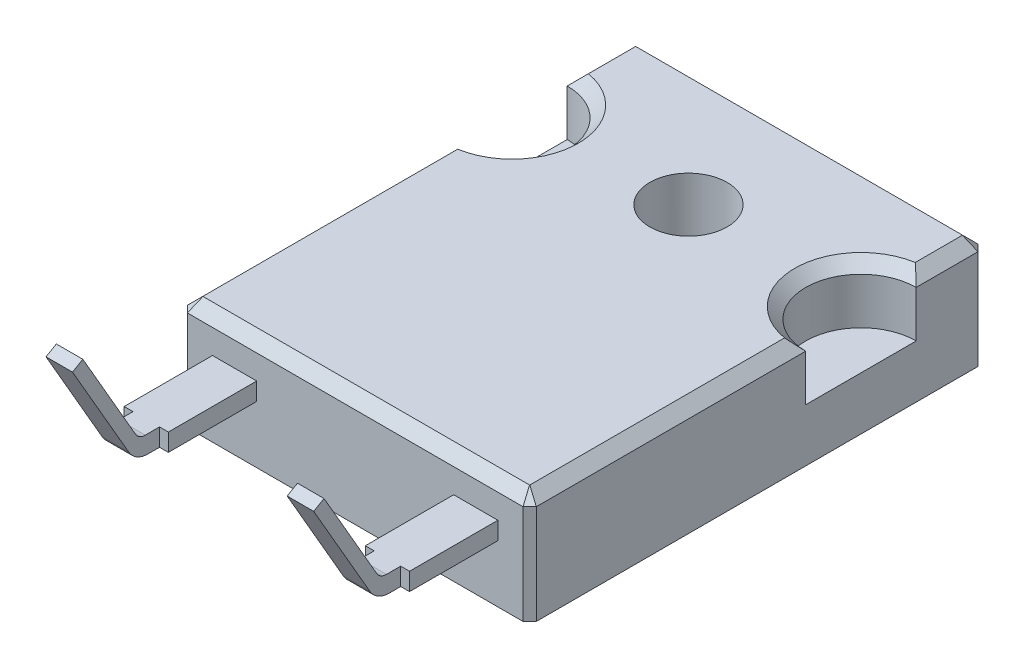
from build123d import *

# Parameters (mm, degrees)
SKETCH_1_R          = 1.75
EXTRUDE_1_DEPTH     = 2.6
EXTRUDE_START       = -2.4
SKETCH_1_3_W        = 15.8
SKETCH_1_3_H        = 20.6
SKETCH_1_3_R        = 1.75
EXTRUDE_2_DEPTH     = 2.4
EXTRUDE_START_2     = 0.2
EXTRUDE_3_DEPTH     = 0.8
EXTRUDE_3_2_DEPTH   = 0.8
CHAMFER_1_SIZE      = 0.3
CHAMFER_2_SIZE      = 0.5
SKETCH_2_W          = 13.8
SKETCH_2_H          = 18.6
SKETCH_2_R          = 1.75
CUT_EXTRUDE_1_DEPTH = 1.5
SKETCH_3_W          = 1.2
SKETCH_3_H          = 0.54
EXTRUDE_6_DEPTH     = 5.68
FILLET_1_R          = 1
FILLET_2_R          = 1
FILLET_3_R          = 0.5
FILLET_4_R          = 0.5


with BuildPart() as part:
    # Эскиз1 → Бобышка-Вытянуть1 (new body)
    with BuildSketch(Plane(origin=(0, 0, 0), x_dir=(1, 0, 0), z_dir=(0, 1, 0))):
        with BuildLine():
            Line((6.46, -10.3), (7.9, -10.3))
            Line((7.9, -10.3), (7.9, 2.2))
            ThreePointArc((7.9, 2.2), (5.4, 4.7), (7.9, 7.2))
            Line((7.9, 7.2), (7.9, 10.3))
            Line((7.9, 10.3), (-7.9, 10.3))
            Line((-7.9, 10.3), (-7.9, 7.2))
            ThreePointArc((-7.9, 7.2), (-5.4, 4.7), (-7.9, 2.2))
            Line((-7.9, 2.2), (-7.9, -10.3))
            Line((-7.9, -10.3), (-6.46, -10.3))
            Line((-6.46, -10.3), (-4.46, -10.3))
            Line((-4.46, -10.3), (4.46, -10.3))
            Line((4.46, -10.3), (6.46, -10.3))
        make_face()
        with Locations((0, 4.79)):
            Circle(SKETCH_1_R, mode=Mode.SUBTRACT)
    extrude(amount=EXTRUDE_1_DEPTH)

    # Эскиз1<3> → Бобышка-Вытянуть2 (add)
    with BuildSketch(Plane(origin=(0, 0, 0), x_dir=(1, 0, 0), z_dir=(0, 1, 0)).offset(EXTRUDE_START)):
        Rectangle(SKETCH_1_3_W, SKETCH_1_3_H)
        with Locations((0, 4.79)):
            Circle(SKETCH_1_3_R, mode=Mode.SUBTRACT)
    extrude(amount=EXTRUDE_2_DEPTH)

    # Фаска1
    chamfer_1_edges = [part.edges().sort_by_distance(p)[0] for p in [
        (-7.9, 0.1, 10.3),
        (-7.9, 0.1, -10.3),
        (7.9, 0.1, -10.3),
        (7.9, 0.1, 10.3),
    ]]
    chamfer(chamfer_1_edges, length=CHAMFER_1_SIZE)

    # Фаска2
    chamfer_2_edges = [part.edges().sort_by_distance(p)[0] for p in [
        (-5.4, 2.6, -4.7),
        (-7.9, 2.6, -8.6),
        (-7.75, 2.6, -10.15),
        (0, 2.6, -10.3),
        (7.75, 2.6, -10.15),
        (7.9, 2.6, -8.6),
        (5.4, 2.6, -4.7),
        (7.9, 2.6, 3.9),
        (7.75, 2.6, 10.15),
        (0, 2.6, 10.3),
        (-7.75, 2.6, 10.15),
        (-7.9, 2.6, 3.9),
    ]]
    chamfer(chamfer_2_edges, length=CHAMFER_2_SIZE)

    # Эскиз2 → Вырез-Вытянуть1 (cut)
    with BuildSketch(Plane.XZ.offset(2.4)):
        Rectangle(SKETCH_2_W, SKETCH_2_H)
        with Locations((0, -4.79)):
            Circle(SKETCH_2_R, mode=Mode.SUBTRACT)
    extrude(amount=-CUT_EXTRUDE_1_DEPTH, mode=Mode.SUBTRACT)


with BuildPart() as body_2:
    # Эскиз1<4> → Бобышка-Вытянуть3 (new body)
    with BuildSketch(Plane(origin=(0, 0, 0), x_dir=(1, 0, 0), z_dir=(0, 1, 0)).offset(EXTRUDE_START_2)):
        Polygon((6.46, -14.3), (6.46, -10.3), (4.46, -10.3), (4.46, -14.3), (4.86, -14.3), (4.86, -15.4), (6.06, -15.4), (6.06, -14.3), align=None)
    extrude(amount=EXTRUDE_3_DEPTH)



with BuildPart() as body_3:
    # Эскиз1<4> → Extrude 3 2 (new body)
    with BuildSketch(Plane(origin=(0, 0, 0), x_dir=(1, 0, 0), z_dir=(0, 1, 0)).offset(EXTRUDE_START_2)):
        Polygon((-4.46, -14.3), (-4.46, -10.3), (-6.46, -10.3), (-6.46, -14.3), (-6.06, -14.3), (-6.06, -15.4), (-4.86, -15.4), (-4.86, -14.3), align=None)
    extrude(amount=EXTRUDE_3_2_DEPTH)


with BuildPart() as body_2_1:
    add(body_2.part)

    add(body_3.part)  # Бобышка-Вытянуть6 merges body 3
    # Эскиз3 → Бобышка-Вытянуть6 (add)
    with BuildSketch(Plane(origin=(0, 6.818395609, 3.93660254), x_dir=(1, 0, 0), z_dir=(0, -0.866025403784438, -0.500000000000001))):
        with Locations((-5.46, 12.966791218)):
            Rectangle(SKETCH_3_W, SKETCH_3_H)
        with Locations((5.46, 12.966791218)):
            Rectangle(SKETCH_3_W, SKETCH_3_H)
    extrude(amount=-EXTRUDE_6_DEPTH)

    # Скругление1
    fillet_1_edges = [body_2_1.edges().sort_by_distance(p)[0] for p in [
        (-5.46, 0.2, 15.4),
    ]]
    fillet(fillet_1_edges, radius=FILLET_1_R)

    # Скругление2
    fillet_2_edges = [body_2_1.edges().sort_by_distance(p)[0] for p in [
        (5.46, 0.2, 15.4),
    ]]
    fillet(fillet_2_edges, radius=FILLET_2_R)

    # Скругление3
    fillet_3_edges = [body_2_1.edges().sort_by_distance(p)[0] for p in [
        (5.46, 1, 15.238341925),
    ]]
    fillet(fillet_3_edges, radius=FILLET_3_R)

    # Скругление4
    fillet_4_edges = [body_2_1.edges().sort_by_distance(p)[0] for p in [
        (-5.46, 1, 15.238341925),
    ]]
    fillet(fillet_4_edges, radius=FILLET_4_R)


solid = Compound([part.part, body_2_1.part])
